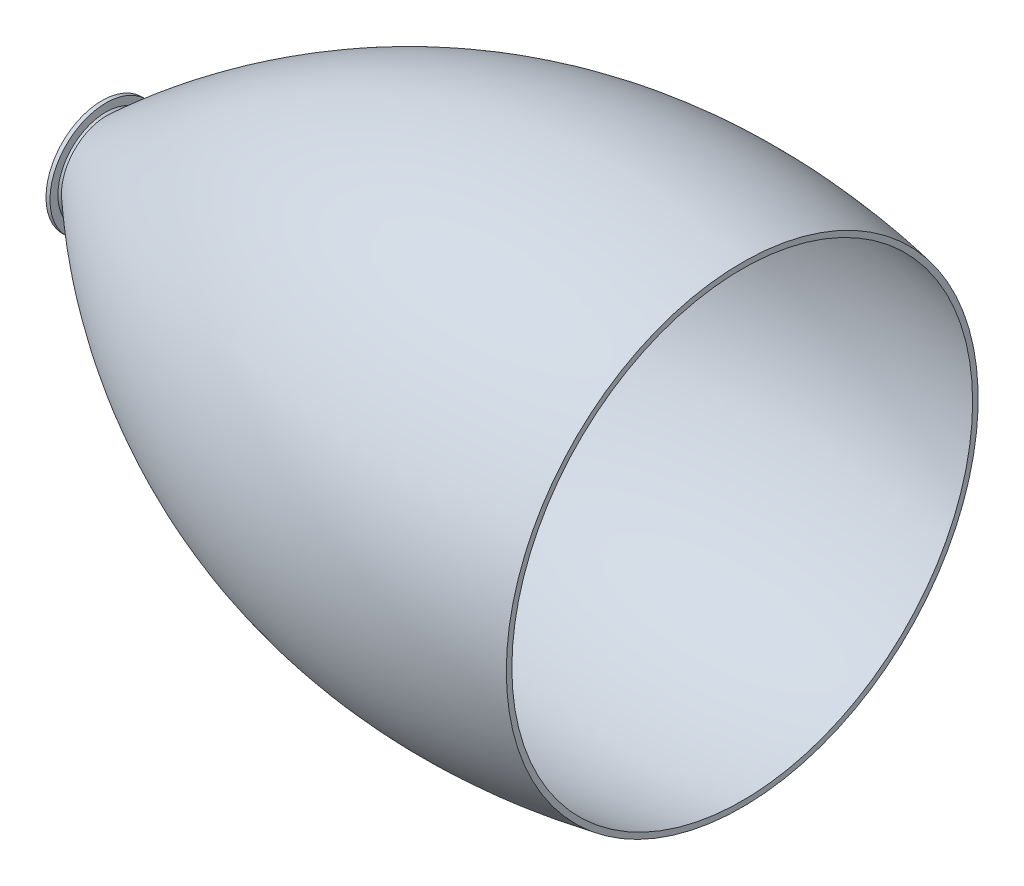
from build123d import *

# Parameters (mm, degrees)
SKETCH4_W           = 2299.140163329
SKETCH4_H           = 1084.867048291
CUT_EXTRUDE1_DEPTH  = 554.228
SKETCH5_R           = 89.428796415
SKETCH5_R_2         = 76.728796415
BOSS_EXTRUDE1_DEPTH = 6.35


with BuildPart() as part:
    # Sketch1 → Revolve3 (revolve)
    with BuildSketch(Plane.XY):
        with BuildLine():
            Line((1016, 368.3), (1016, 377.19))
            add(Edge.make_bspline(
                [(0, 72.39), (446.417850058, 483.305663406), (1016, 377.19)],
                knots=[0, 0, 0, 1, 1, 1], degree=2))
            add(Edge.make_bspline(
                [(0, 72.39), (-189.353547542, 181.782792201), (-412.824178468, 153.699870936)],
                knots=[0, 0, 0, 1, 1, 1], degree=2))
            Line((-412.824178468, 153.699870936), (-412.824178468, 144.809870936))
            add(Edge.make_bspline(
                [(0, 63.5), (-192.283511437, 162.67820459), (-412.824178468, 144.809870936)],
                knots=[0, 0, 0, 1, 1, 1], degree=2))
            add(Edge.make_bspline(
                [(0, 63.5), (448.54917569, 461.978752766), (1016, 368.3)],
                knots=[0, 0, 0, 1, 1, 1], degree=2))
        make_face()
    revolve(axis=Axis((-1229.828239288, 0, 0), (1, 0, 0)))

    # Sketch4 → Cut-Extrude1 (cut)
    with BuildSketch(Plane.ZY.offset(7.62)):
        with Locations((-63.658537287, 96.480710784)):
            Rectangle(SKETCH4_W, SKETCH4_H)
    extrude(amount=CUT_EXTRUDE1_DEPTH, mode=Mode.SUBTRACT)


with BuildPart() as body_2:
    # Sketch5 → Boss-Extrude1 (new body)
    with BuildSketch(Plane.ZY.offset(7.62)):
        Circle(SKETCH5_R)
        Circle(SKETCH5_R_2, mode=Mode.SUBTRACT)
    extrude(amount=-BOSS_EXTRUDE1_DEPTH)


solid = Compound([part.part, body_2.part])
